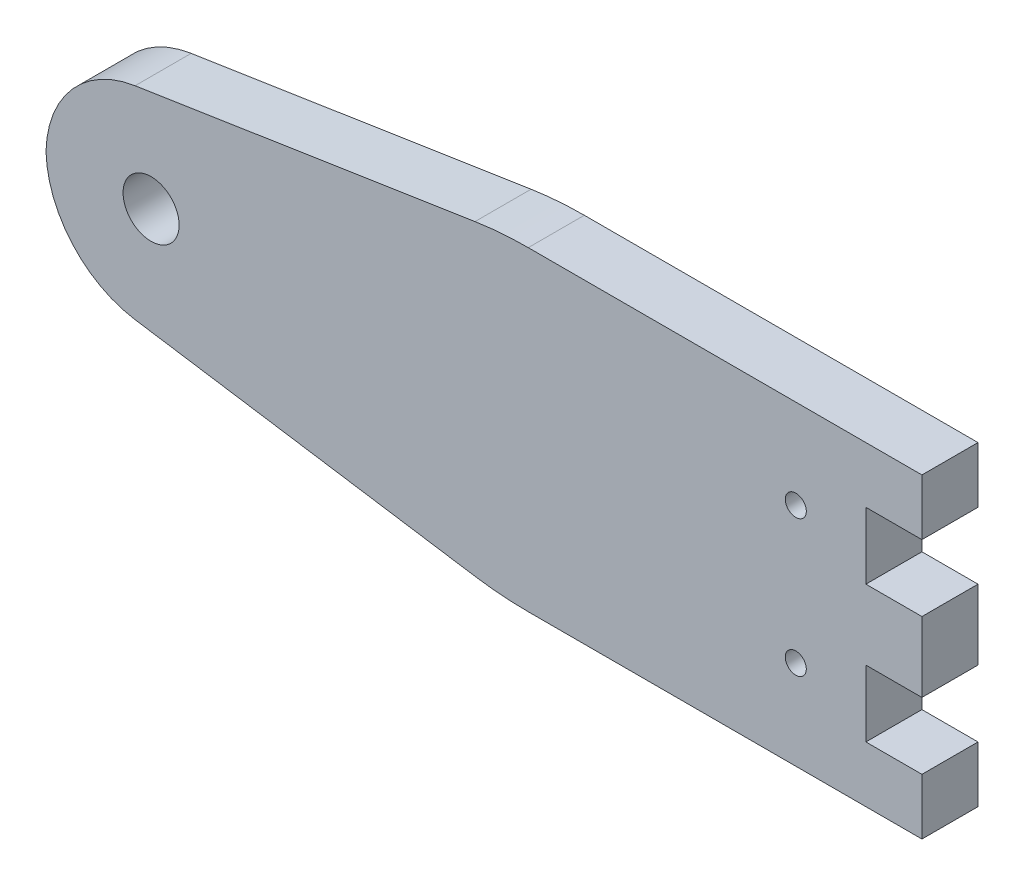
from build123d import *

# Parameters (mm, degrees)
BOSS_EXTRUDE1_DEPTH = 8
CHAMFER1_SIZE       = 10
CHAMFER1_SIZE2      = 65
CHAMFER2_SIZE       = 65
CHAMFER2_SIZE2      = 10
FILLET2_R           = 15
FILLET3_R           = 50
SKETCH2_R           = 4
CUT_EXTRUDE1_DEPTH  = 80
SKETCH4_R           = 1.5
CUT_EXTRUDE3_DEPTH  = 15


with BuildPart() as part:
    # Sketch1 → Boss-Extrude1 (new body)
    with BuildSketch(Plane.XY):
        Polygon((0, 17.5), (0, 27.5), (-8, 27.5), (-8, 37), (0, 37), (0, 45), (-125, 45), (-125, 22.5), (-125, 0), (0, 0), (0, 8), (-8, 8), (-8, 17.5), align=None)
    extrude(amount=BOSS_EXTRUDE1_DEPTH)

    # Chamfer1
    chamfer1_edges = [part.edges().sort_by_distance(p)[0] for p in [
        (-125, 0, 4),
    ]]
    chamfer1_side = [part.faces().sort_by_distance(p)[0] for p in [
        (-125, 22.5, 4),
    ]]
    chamfer(chamfer1_edges, length=CHAMFER1_SIZE, length2=CHAMFER1_SIZE2, reference=chamfer1_side[0])

    # Chamfer2
    chamfer2_edges = [part.edges().sort_by_distance(p)[0] for p in [
        (-125, 45, 4),
    ]]
    chamfer2_side = [part.faces().sort_by_distance(p)[0] for p in [
        (-62.5, 45, 4),
    ]]
    chamfer(chamfer2_edges, length=CHAMFER2_SIZE, length2=CHAMFER2_SIZE2, reference=chamfer2_side[0])

    # Fillet2
    # the kernel refuses this fillet: 15 mm, written as the material it takes off along each edge
    with BuildSketch(Plane(origin=(-125, 10, -32.171960879), x_dir=(0, 1, 0), z_dir=(0, 0, 1))) as fillet2_piece_1:
        with BuildLine():
            CenterArc((FILLET2_R * 0.857918956767, -FILLET2_R), FILLET2_R, 90, 81.253837737)
            Line((-FILLET2_R * 0.130452740884, -FILLET2_R * 0.847942815746), (0, 0))
            Line((0, 0), (FILLET2_R * 0.857918956767, 0))
        make_face()
    extrude(amount=72.343921757, mode=Mode.SUBTRACT)
    with BuildSketch(Plane(origin=(-125, 35, -32.171960879), x_dir=(0, -1, 0), z_dir=(0, 0, 1))) as fillet2_piece_2:
        with BuildLine():
            CenterArc((FILLET2_R * 0.857918956767, FILLET2_R), FILLET2_R, 188.746162263, 81.253837737)
            Line((-FILLET2_R * 0.130452740884, FILLET2_R * 0.847942815746), (0, 0))
            Line((0, 0), (FILLET2_R * 0.857918956767, 0))
        make_face()
    extrude(amount=72.343921757, mode=Mode.SUBTRACT)

    # Fillet3
    fillet3_edges = [part.edges().sort_by_distance(p)[0] for p in [
        (-60, 0, 4),
        (-60, 45, 4),
    ]]
    fillet(fillet3_edges, radius=FILLET3_R)

    # Sketch2 → Cut-Extrude1 (cut)
    with BuildSketch(Plane.XY.offset(8)):
        with Locations((-110, 22.868784351)):
            Circle(SKETCH2_R)
    extrude(amount=-CUT_EXTRUDE1_DEPTH, mode=Mode.SUBTRACT)

    # Sketch4 → Cut-Extrude3 (cut)
    with BuildSketch(Plane.XY.offset(8)):
        with Locations((-18, 32.25)):
            Circle(SKETCH4_R)
        with Locations((-18, 12.75)):
            Circle(SKETCH4_R)
    extrude(amount=-CUT_EXTRUDE3_DEPTH, mode=Mode.SUBTRACT)


solid = part.part
